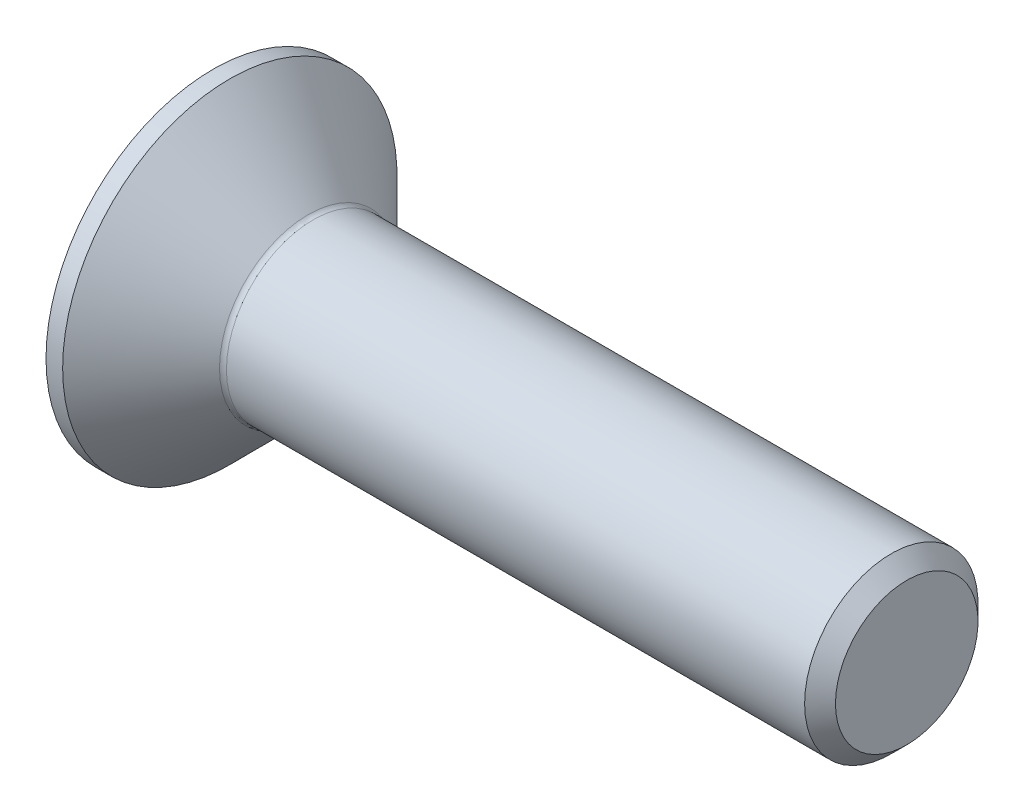
from build123d import *

# Parameters (mm, degrees)
FILLET1_R   = 0.2
HEX_START   = -2.3
HEX_2_DEPTH = 2.3


with BuildPart() as part:
    # BodySke → BaseBody (revolve)
    with BuildSketch(Plane.XY, mode=Mode.PRIVATE) as basebody_sk:
        Polygon((0, 0), (0, 4.82), (0.48, 4.82), (2.8, 2.5), (19.555, 2.5), (20, 2.055), (20, 0), align=None)
    revolve(basebody_sk.sketch.rotate(Axis((0, 0, 0), (1, 0, 0)), 90), axis=Axis((0, 0, 0), (1, 0, 0)))

    # Fillet1
    fillet1_edges = [part.edges().sort_by_distance(p)[0] for p in [
        (2.8, 0, -2.5),
    ]]
    fillet(fillet1_edges, radius=FILLET1_R)

    # Hex 2: read off the stored shape, not the designer's step
    # Hex 2 outline → Hex 2 (cut)
    with BuildSketch(Plane.ZY.offset(HEX_START)):
        Polygon((-1.51, -0.871798906), (0, -1.743597813), (1.51, -0.871798906), (1.51, 0.871798906), (0, 1.743597813), (-1.51, 0.871798906), align=None)
    extrude(amount=HEX_2_DEPTH, mode=Mode.SUBTRACT)

    # Hex 2 2 outline → Hex 2 2 (revolve, cut)
    with BuildSketch(Plane.YX):
        Polygon((1.51, 2.3), (0, 3.171798906), (0, 2.3), align=None)
    revolve(axis=Axis((0, 0, 0), (1, 0, 0)), mode=Mode.SUBTRACT)


solid = part.part
